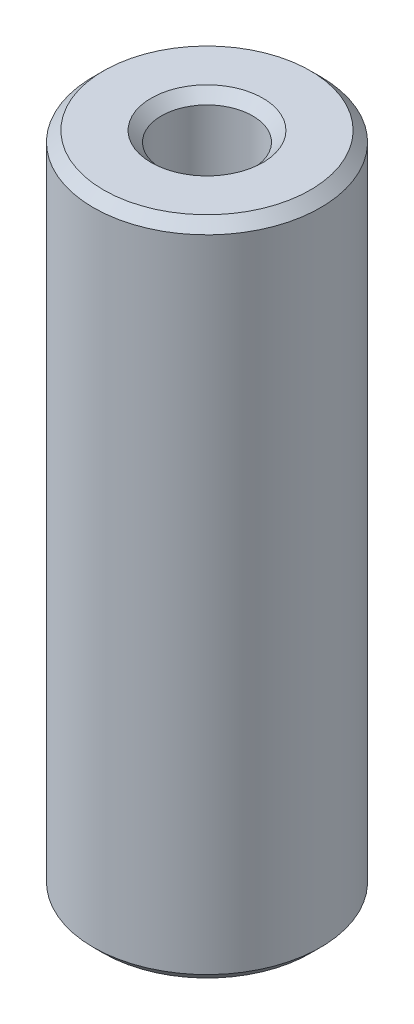
from build123d import *

# Parameters (mm, degrees)
SKETCH1_R           = 12.5
BOSS_EXTRUDE1_DEPTH = 72.771207772
SKETCH2_R           = 5.023762975
CUT_EXTRUDE1_DEPTH  = 75.887573606
CHAMFER1_SIZE       = 1.123423548


with BuildPart() as part:
    # Sketch1 → Boss-Extrude1 (new body)
    with BuildSketch(Plane(origin=(0, 0, 0), x_dir=(1, 0, 0), z_dir=(0, 1, 0))):
        Circle(SKETCH1_R)
    extrude(amount=BOSS_EXTRUDE1_DEPTH)

    # Sketch2 → Cut-Extrude1 (cut, through all)
    with BuildSketch(Plane(origin=(0, 0, 0), x_dir=(1, 0, 0), z_dir=(0, 1, 0))):
        Circle(SKETCH2_R)
    extrude(amount=CUT_EXTRUDE1_DEPTH, mode=Mode.SUBTRACT)

    # Chamfer1
    chamfer1_edges = [part.edges().sort_by_distance(p)[0] for p in [
        (-5.023762975, 72.771207772, 0),
        (-5.023762975, 0, 0),
        (-12.5, 0, 0),
        (-12.5, 72.771207772, 0),
    ]]
    chamfer(chamfer1_edges, length=CHAMFER1_SIZE)


solid = part.part
